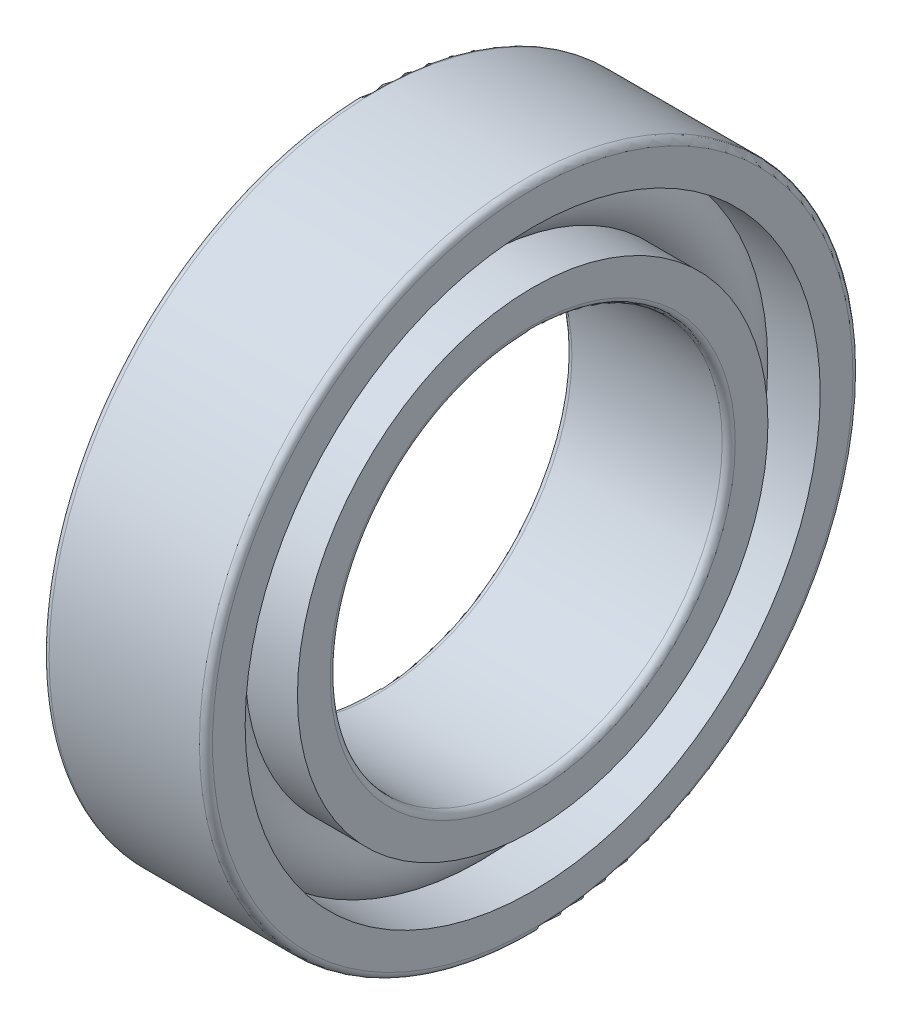
from build123d import *

# Parameters (mm, degrees)
CAGSPISKE_W     = 0.12
CAGSPISKE_H     = 0.2
CAGESPINE_ANGLE = 0.001
BALSIMSKE_R     = 0.6


with BuildPart() as part:
    # CagSpiSke → CageSpine (revolve)
    with BuildSketch(Plane.XY):
        with Locations((0, 4)):
            Rectangle(CAGSPISKE_W, CAGSPISKE_H)
    revolve(axis=Axis((-20.6375, 0, 0), (-1, 0, 0)), revolution_arc=CAGESPINE_ANGLE)

    # BalSimSke → BallsSimplified (revolve)
    with BuildSketch(Plane.XY):
        with Locations((0, 4)):
            Circle(BALSIMSKE_R)
    revolve(axis=Axis((-10, 0, 0), (1, 0, 0)))

    # InnRacSke → InnerRace (revolve)
    with BuildSketch(Plane.XY):
        with BuildLine():
            Line((-0.413067791, 3.6), (-1.25, 3.6))
            Line((-1.25, 3.6), (-1.25, 3.1))
            ThreePointArc((-1.25, 3.1), (-1.220710678, 3.029289322), (-1.15, 3))
            Line((-1.15, 3), (1.15, 3))
            ThreePointArc((1.15, 3), (1.220710678, 3.029289322), (1.25, 3.1))
            Line((1.25, 3.1), (1.25, 3.6))
            Line((1.25, 3.6), (0.413067791, 3.6))
            ThreePointArc((0.413067791, 3.6), (0, 3.425), (-0.413067791, 3.6))
        make_face()
    revolve(axis=Axis((-20.6375, 0, 0), (1, 0, 0)))

    # OutRacSke → OuterRace (revolve)
    with BuildSketch(Plane.XY):
        with BuildLine():
            Line((-0.413067791, 4.4), (-1.25, 4.4))
            Line((-1.25, 4.4), (-1.25, 4.9))
            ThreePointArc((-1.25, 4.9), (-1.220710678, 4.970710678), (-1.15, 5))
            Line((-1.15, 5), (1.15, 5))
            ThreePointArc((1.15, 5), (1.220710678, 4.970710678), (1.25, 4.9))
            Line((1.25, 4.9), (1.25, 4.4))
            Line((1.25, 4.4), (0.413067791, 4.4))
            ThreePointArc((0.413067791, 4.4), (0, 4.575), (-0.413067791, 4.4))
        make_face()
    revolve(axis=Axis((-20.6375, 0, 0), (1, 0, 0)))


solid = part.part
